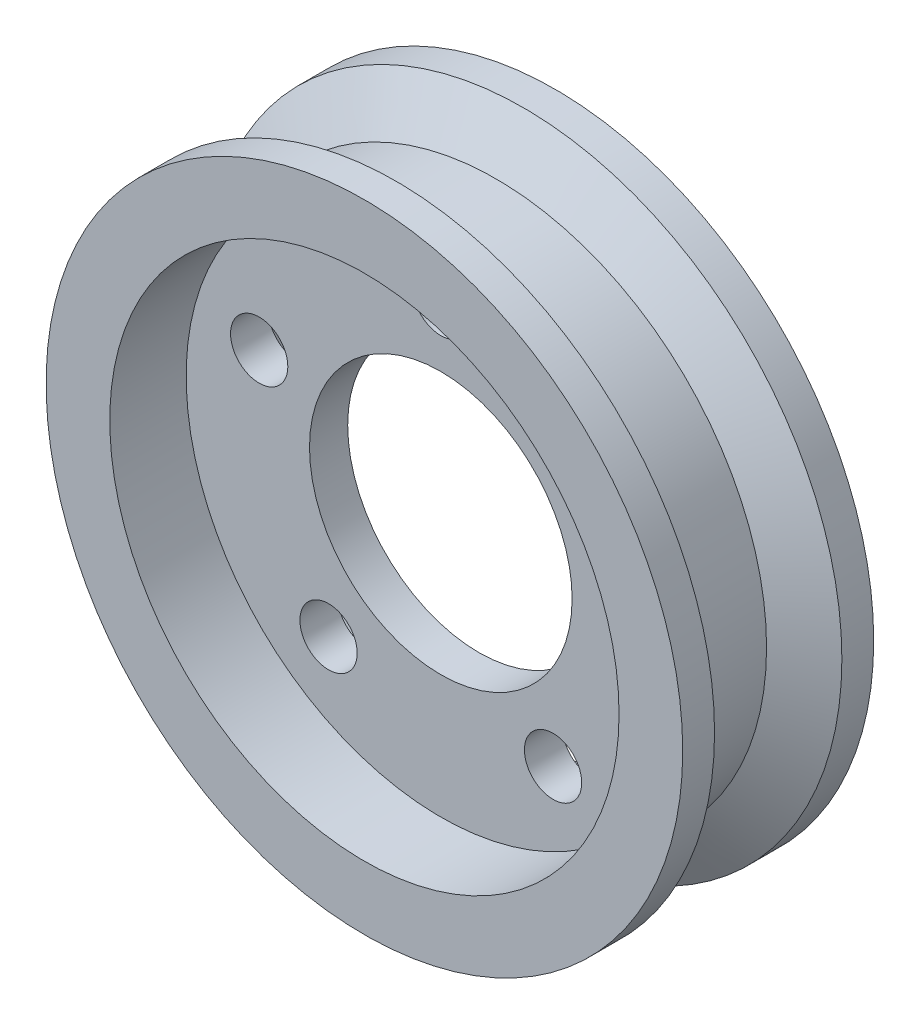
from build123d import *

# Parameters (mm, degrees)
SKETCH1_R           = 10
BOSS_EXTRUDE1_DEPTH = 3
SKETCH2_R           = 8
CUT_EXTRUDE1_DEPTH  = 2.4
SKETCH6_R           = 4.125
CUT_EXTRUDE2_DEPTH  = 15.593149078
SKETCH3_R           = 0.9
CUT_EXTRUDE3_DEPTH  = 15.593149078


with BuildPart() as part:
    # Sketch1 → Boss-Extrude1 (new, symmetric)
    with BuildSketch(Plane.XY):
        Circle(SKETCH1_R)
        with BuildLine():
            Line((-1.521572539, 1.983637318), (-1.521572539, -2.016362682))
            ThreePointArc((-1.521572539, -2.016362682), (-0.016245384, -2.500087973), (1.478251514, -1.983871914))
            Line((1.478251514, -1.983871914), (1.478251514, 2.016128086))
            ThreePointArc((1.478251514, 2.016128086), (-0.02707564, 2.499853378), (-1.521572539, 1.983637318))
        make_face(mode=Mode.SUBTRACT)
    extrude(amount=BOSS_EXTRUDE1_DEPTH, both=True)

    # Sketch2 → Cut-Extrude1 (cut)
    with BuildSketch(Plane.XY.offset(3)):
        Circle(SKETCH2_R)
    cut_extrude1 = extrude(amount=-CUT_EXTRUDE1_DEPTH, mode=Mode.SUBTRACT)

    # Mirror1: Cut-Extrude1 across plane
    add(cut_extrude1.mirror(Plane.XY), mode=Mode.SUBTRACT)

    # Sketch5 → Cut-Revolve1 (revolve, cut)
    with BuildSketch(Plane(origin=(0, 0, 0), x_dir=(1, 0, 0), z_dir=(0, 1, 0))):
        Polygon((-10, 2), (-8.5, 1.133974596), (-8.5, -1.133974596), (-10, -2), align=None)
    revolve(axis=Axis((0, 0, 0), (0, 0, -1)), mode=Mode.SUBTRACT)

    # Sketch6 → Cut-Extrude2 (cut, through all)
    with BuildSketch(Plane(origin=(0, 0, -0.6), x_dir=(-1, 0, 0), z_dir=(0, 0, -1))):
        Circle(SKETCH6_R)
    extrude(amount=-CUT_EXTRUDE2_DEPTH, mode=Mode.SUBTRACT)

    # Sketch3 → Cut-Extrude3 (cut, through all)
    with BuildSketch(Plane.XY.offset(0.6)):
        with Locations((0, 6)):
            Circle(SKETCH3_R)
        with Locations((5.706339098, 1.854101966)):
            Circle(SKETCH3_R)
        with Locations((3.526711514, -4.854101966)):
            Circle(SKETCH3_R)
        with Locations((-3.526711514, -4.854101966)):
            Circle(SKETCH3_R)
        with Locations((-5.706339098, 1.854101966)):
            Circle(SKETCH3_R)
    extrude(amount=-CUT_EXTRUDE3_DEPTH, mode=Mode.SUBTRACT)


solid = part.part
